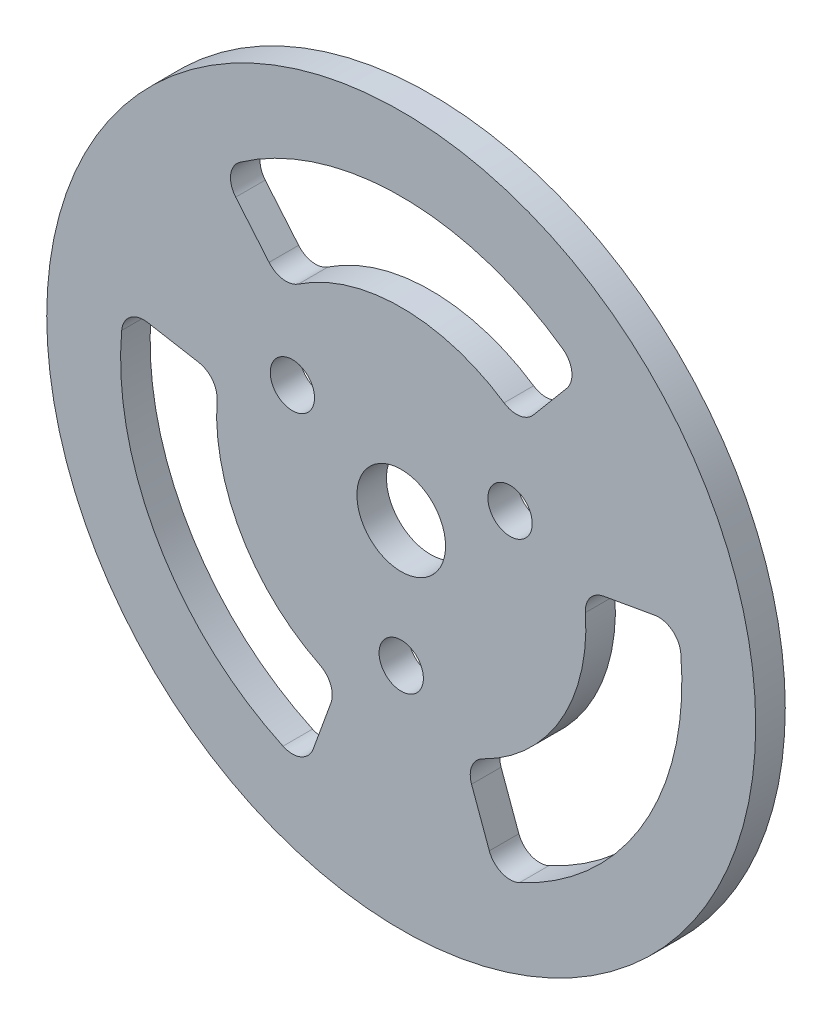
from build123d import *

# Parameters (mm, degrees)
SKETCH_1_R      = 24
SKETCH_1_R_2    = 3
SKETCH_1_R_3    = 1.5
EXTRUDE_1_DEPTH = 2
FILLET_1_R      = 1.5


with BuildPart() as part:
    # 草图1 → 凸台-拉伸1 (new body)
    with BuildSketch(Plane.XY):
        Circle(SKETCH_1_R)
        Circle(SKETCH_1_R_2, mode=Mode.SUBTRACT)
        with Locations((-7.368432559, 4.254166522)):
            Circle(SKETCH_1_R_3, mode=Mode.SUBTRACT)
        with Locations((7.368432559, 4.254166522)):
            Circle(SKETCH_1_R_3, mode=Mode.SUBTRACT)
        with Locations((0, -8.508333043)):
            Circle(SKETCH_1_R_3, mode=Mode.SUBTRACT)
        with BuildLine():
            Line((8.034845121, 9.575555539), (12.212964584, 14.554844419))
            ThreePointArc((12.212964584, 14.554844419), (0, 19), (-12.212964584, 14.554844419))
            Line((-12.212964584, 14.554844419), (-8.034845121, 9.575555539))
            ThreePointArc((-8.034845121, 9.575555539), (0, 12.5), (8.034845121, 9.575555539))
        make_face(mode=Mode.SUBTRACT)
        with BuildLine():
            Line((12.310096913, 2.170602221), (18.711347307, 3.299315376))
            ThreePointArc((18.711347307, 3.299315376), (16.454482672, -9.5), (6.498382723, -17.854159795))
            Line((6.498382723, -17.854159795), (4.275251792, -11.74615776))
            ThreePointArc((4.275251792, -11.74615776), (10.825317547, -6.25), (12.310096913, 2.170602221))
        make_face(mode=Mode.SUBTRACT)
        with BuildLine():
            Line((-4.275251792, -11.74615776), (-6.498382723, -17.854159795))
            ThreePointArc((-6.498382723, -17.854159795), (-16.454482672, -9.5), (-18.711347307, 3.299315376))
            Line((-18.711347307, 3.299315376), (-12.310096913, 2.170602221))
            ThreePointArc((-12.310096913, 2.170602221), (-10.825317547, -6.25), (-4.275251792, -11.74615776))
        make_face(mode=Mode.SUBTRACT)
    extrude(amount=EXTRUDE_1_DEPTH)

    # 圆角1
    fillet_1_edges = [part.edges().sort_by_distance(p)[0] for p in [
        (-6.498382723, -17.854159795, 1),
        (-4.275251792, -11.74615776, 1),
        (-12.310096913, 2.170602221, 1),
        (-18.711347307, 3.299315376, 1),
        (12.310096913, 2.170602221, 1),
        (18.711347307, 3.299315376, 1),
        (6.498382723, -17.854159795, 1),
        (4.275251792, -11.74615776, 1),
        (-12.212964584, 14.554844419, 1),
        (-8.034845121, 9.575555539, 1),
        (8.034845121, 9.575555539, 1),
        (12.212964584, 14.554844419, 1),
    ]]
    fillet(fillet_1_edges, radius=FILLET_1_R)


solid = part.part
